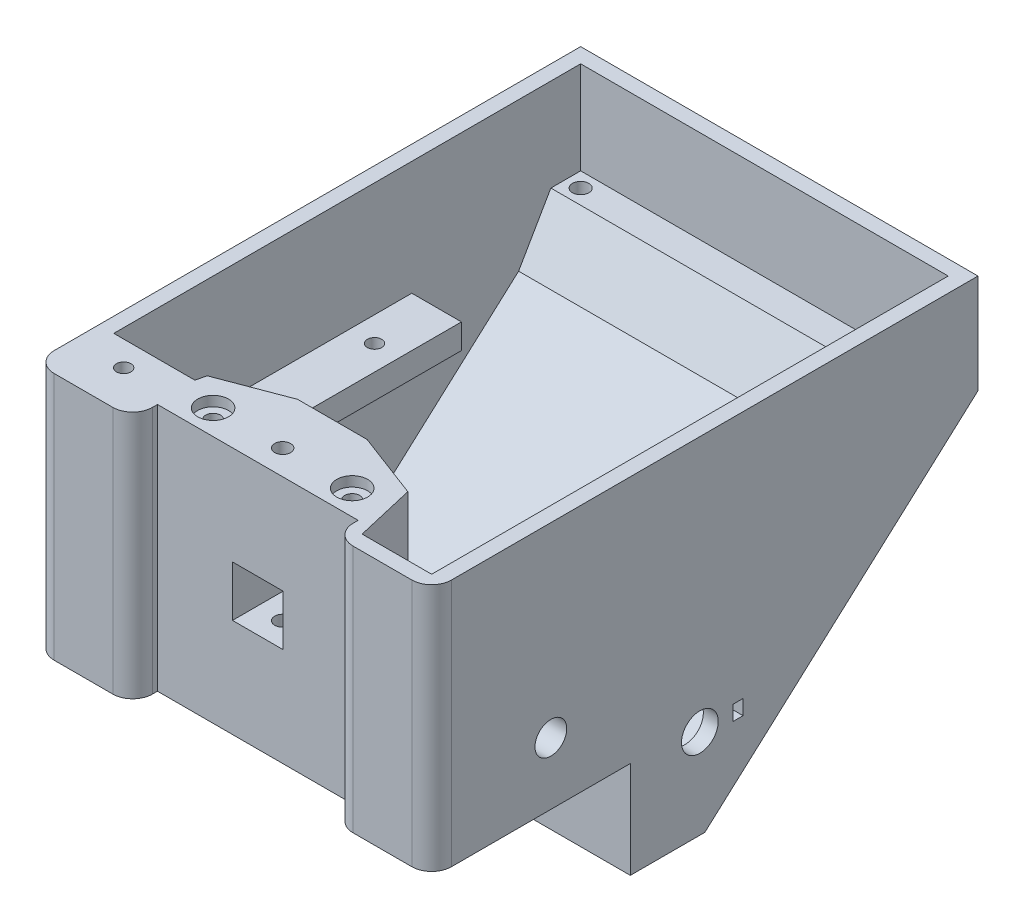
from build123d import *

# Parameters (mm, degrees)
BOSS_EXTRUDE1_DEPTH  = 80
SHELL1_T             = -3
SKETCH3_W            = 46
SKETCH3_H            = 47
BOSS_EXTRUDE2_DEPTH  = 17
SKETCH4_W            = 10.2
SKETCH4_H            = 10.2
CUT_EXTRUDE1_DEPTH   = 20
SKETCH6_W            = 15
SKETCH6_H            = 12.8
CUT_EXTRUDE2_DEPTH   = 3
SKETCH7_W            = 40.4
SKETCH7_H            = 50
CUT_EXTRUDE3_DEPTH   = 5
FILLET1_R            = 4
CUT_EXTRUDE7_DEPTH   = 47
SKETCH13_R           = 1.5
CUT_EXTRUDE8_DEPTH   = 25
SKETCH14_R           = 3.1
CUT_EXTRUDE9_DEPTH   = 2
SKETCH17_W           = 45
SKETCH17_H           = 5
BOSS_EXTRUDE5_DEPTH  = 74
CUT_EXTRUDE10_REACH  = 126.093
SKETCH18_W           = 54
SKETCH18_H           = 45
CUT_EXTRUDE11_REACH  = 126.093
SKETCH19_R           = 1.45
BOSS_EXTRUDE6_DEPTH  = 47
SKETCH22_R           = 1.45
CUT_EXTRUDE12_DEPTH  = 135.415364765
CUT_EXTRUDE13_REACH  = 126.857
SKETCH24_R           = 3.7
SKETCH24_W           = 2
SKETCH24_H           = 3
BOSS_EXTRUDE7_DEPTH  = 74
SKETCH27_R           = 1.65
CUT_EXTRUDE14_DEPTH  = 10
CUT_EXTRUDE15_START  = -3
CUT_EXTRUDE15_DEPTH  = 32
CUT_EXTRUDE16_DEPTH  = 30
BOSS_EXTRUDE8_DEPTH  = 20
SKETCH31_R           = 1.5
CUT_EXTRUDE17_DEPTH  = 123.649786567
CUT_EXTRUDE18_DEPTH  = 15
CUT_EXTRUDE19_REACH  = 126.093
SKETCH33_W           = 10
SKETCH33_H           = 5
SKETCH34_R           = 1.6
CUT_EXTRUDE20_DEPTH  = 135.415364765
CUT_EXTRUDE22_DEPTH  = 14
CUT_EXTRUDE23_REACH  = 126.857
SKETCH37_R           = 3.2
SKETCH38_W           = 10
SKETCH38_H           = 18.980735551
SKETCH38_R           = 3.2
BOSS_EXTRUDE9_DEPTH  = 3
CUT_EXTRUDE24_REACH  = 124.956
SKETCH40_R           = 3.7
SKETCH40_W           = 2
SKETCH40_H           = 3
CHAMFER1_SIZE        = 10
CHAMFER1_SIZE_2      = 17.320508076
SKETCH41_W           = 6.5
SKETCH41_H           = 6.5
CUT_EXTRUDE25_DEPTH  = 1
SKETCH42_R           = 2.25
CUT_EXTRUDE26_DEPTH  = 125.659140511
SKETCH43_R           = 4
SKETCH43_R_2         = 2.25
BOSS_EXTRUDE10_DEPTH = 2
FILLET2_R            = 2
FILLET3_R            = 1
SKETCH44_W           = 9
SKETCH44_H           = 9
SKETCH44_W_2         = 6.5
SKETCH44_H_2         = 6.5
BOSS_EXTRUDE11_DEPTH = 2


# Some blends are built 0.0001 mm under size
with BuildPart() as part:
    # Sketch2 → Boss-Extrude1 (new body)
    with BuildSketch(Plane(origin=(0, 0, 0), x_dir=(0, 0, -1), z_dir=(1, 0, 0))):
        Polygon((-27.320490368, 20.998248687), (-27.320490368, -29.001751313), (12.679509632, -29.001751313), (12.679509632, -48.511383538), (27.679509632, -48.511383538), (82.679509632, 0.998248687), (82.679509632, 20.998248687), align=None)
    extrude(amount=BOSS_EXTRUDE1_DEPTH)

    # Shell1
    shell1_openings = [part.faces().sort_by_distance(p)[0] for p in [
        (40, 20.998248687, -27.679509632),
    ]]
    offset(amount=SHELL1_T, openings=shell1_openings, kind=Kind.INTERSECTION)

    # Sketch3 → Boss-Extrude2 (add)
    with BuildSketch(Plane(origin=(0, 0, 24.320490368), x_dir=(-1, 0, 0), z_dir=(0, 0, -1))):
        with Locations((-40, -2.501751313)):
            Rectangle(SKETCH3_W, SKETCH3_H)
    extrude(amount=BOSS_EXTRUDE2_DEPTH)

    # Sketch4 → Cut-Extrude1 (cut)
    with BuildSketch(Plane.XY.offset(27.320490368)):
        with Locations((40, -4.001751313)):
            Rectangle(SKETCH4_W, SKETCH4_H)
    extrude(amount=-CUT_EXTRUDE1_DEPTH, mode=Mode.SUBTRACT)

    # Sketch6 → Cut-Extrude2 (cut)
    with BuildSketch(Plane.XZ.offset(29.001751313)):
        with Locations((28.5, 0.920490368)):
            Rectangle(SKETCH6_W, SKETCH6_H)
        with Locations((51.5, 0.920490368)):
            Rectangle(SKETCH6_W, SKETCH6_H)
    extrude(amount=-CUT_EXTRUDE2_DEPTH, mode=Mode.SUBTRACT)

    # Sketch7 → Cut-Extrude3 (cut)
    with BuildSketch(Plane.XY.offset(27.320490368)):
        with Locations((40, -4.001751313)):
            Rectangle(SKETCH7_W, SKETCH7_H)
    extrude(amount=-CUT_EXTRUDE3_DEPTH, mode=Mode.SUBTRACT)

    # Fillet1
    fillet1_edges = [part.edges().sort_by_distance(p)[0] for p in [
        (19.8, -4.001751313, 27.320490368),
        (60.2, -4.001751313, 27.320490368),
        (80, -4.001751313, 27.320490368),
        (0, -4.001751313, 27.320490368),
    ]]
    fillet(fillet1_edges, radius=FILLET1_R)

    # Sketch12 → Cut-Extrude7 (cut)
    with BuildSketch(Plane(origin=(0, 20.998248687, 0), x_dir=(1, 0, 0), z_dir=(0, 1, 0))):
        Polygon((33, -7.320490368), (19.8, -12.320490368), (17, -24.320490368), (17, -7.320490368), align=None)
        Polygon((47, -7.320490368), (63, -7.320490368), (63, -24.320490368), (60.2, -12.320490368), align=None)
    extrude(amount=-CUT_EXTRUDE7_DEPTH, mode=Mode.SUBTRACT)

    # Sketch13 → Cut-Extrude8 (cut)
    with BuildSketch(Plane(origin=(0, 20.998248687, 0), x_dir=(1, 0, 0), z_dir=(0, 1, 0))):
        with Locations(Location((26, -17.320490368, 0), (0, 0, 270))):
            Circle(SKETCH13_R)
        with Locations(Location((54, -17.320490368, 0), (0, 0, 270))):
            Circle(SKETCH13_R)
    extrude(amount=-CUT_EXTRUDE8_DEPTH, mode=Mode.SUBTRACT)

    # Sketch14 → Cut-Extrude9 (cut)
    with BuildSketch(Plane(origin=(0, 20.998248687, 0), x_dir=(1, 0, 0), z_dir=(0, 1, 0))):
        with Locations(Location((26, -17.320490368, 0), (0, 0, 270))):
            Circle(SKETCH14_R)
        with Locations(Location((54, -17.320490368, 0), (0, 0, 270))):
            Circle(SKETCH14_R)
    extrude(amount=-CUT_EXTRUDE9_DEPTH, mode=Mode.SUBTRACT)

    # Sketch17 → Boss-Extrude5 (add)
    with BuildSketch(Plane.ZY.offset(-77)):
        with Locations((-23.179509632, -4.501751313)):
            Rectangle(SKETCH17_W, SKETCH17_H)
    extrude(amount=BOSS_EXTRUDE5_DEPTH)

    # Sketch18 → Cut-Extrude10 (cut, up to next)
    with BuildSketch(Plane(origin=(0, -2.001751313, 0), x_dir=(1, 0, 0), z_dir=(0, 1, 0)), mode=Mode.PRIVATE) as cut_extrude10_sk1:
        with Locations((40, 23.179509632)):
            Rectangle(SKETCH18_W, SKETCH18_H)
    cut_extrude10_tool1 = extrude(cut_extrude10_sk1.sketch, amount=-CUT_EXTRUDE10_REACH, mode=Mode.PRIVATE) & part.part
    add(cut_extrude10_tool1.solids().sort_by_distance((40, -2.001751, -23.17951))[0], mode=Mode.SUBTRACT)

    # Sketch19 → Cut-Extrude11 (cut, up to next)
    with BuildSketch(Plane(origin=(0, -2.001751313, 0), x_dir=(1, 0, 0), z_dir=(0, 1, 0)), mode=Mode.PRIVATE) as cut_extrude11_sk1:
        with Locations(Location((72, 37.179509632, 0), (0, 0, 270))):
            Circle(SKETCH19_R)
    cut_extrude11_tool1 = extrude(cut_extrude11_sk1.sketch, amount=-CUT_EXTRUDE11_REACH, mode=Mode.PRIVATE) & part.part
    # Sketch19 → Cut-Extrude11 (cut, up to next)
    with BuildSketch(Plane(origin=(0, -2.001751313, 0), x_dir=(1, 0, 0), z_dir=(0, 1, 0)), mode=Mode.PRIVATE) as cut_extrude11_sk2:
        with Locations(Location((72, 6.179509632, 0), (0, 0, 270))):
            Circle(SKETCH19_R)
    cut_extrude11_tool2 = extrude(cut_extrude11_sk2.sketch, amount=-CUT_EXTRUDE11_REACH, mode=Mode.PRIVATE) & part.part
    # Sketch19 → Cut-Extrude11 (cut, up to next)
    with BuildSketch(Plane(origin=(0, -2.001751313, 0), x_dir=(1, 0, 0), z_dir=(0, 1, 0)), mode=Mode.PRIVATE) as cut_extrude11_sk3:
        with Locations(Location((8, 33.179509632, 0), (0, 0, 270))):
            Circle(SKETCH19_R)
    cut_extrude11_tool3 = extrude(cut_extrude11_sk3.sketch, amount=-CUT_EXTRUDE11_REACH, mode=Mode.PRIVATE) & part.part
    # Sketch19 → Cut-Extrude11 (cut, up to next)
    with BuildSketch(Plane(origin=(0, -2.001751313, 0), x_dir=(1, 0, 0), z_dir=(0, 1, 0)), mode=Mode.PRIVATE) as cut_extrude11_sk4:
        with Locations(Location((8, 6.179509632, 0), (0, 0, 270))):
            Circle(SKETCH19_R)
    cut_extrude11_tool4 = extrude(cut_extrude11_sk4.sketch, amount=-CUT_EXTRUDE11_REACH, mode=Mode.PRIVATE) & part.part
    add(cut_extrude11_tool1.solids().sort_by_distance((72, -2.001751, -37.17951))[0], mode=Mode.SUBTRACT)
    add(cut_extrude11_tool2.solids().sort_by_distance((72, -2.001751, -6.17951))[0], mode=Mode.SUBTRACT)
    add(cut_extrude11_tool3.solids().sort_by_distance((8, -2.001751, -33.17951))[0], mode=Mode.SUBTRACT)
    add(cut_extrude11_tool4.solids().sort_by_distance((8, -2.001751, -6.17951))[0], mode=Mode.SUBTRACT)

    # Sketch21 → Boss-Extrude6 (add)
    with BuildSketch(Plane(origin=(0, -26.001751313, 0), x_dir=(1, 0, 0), z_dir=(0, 1, 0))):
        Polygon((3, -24.320490368), (3, -14.320490368), (19.333333333, -14.320490368), (17, -24.320490368), align=None)
    extrude(amount=BOSS_EXTRUDE6_DEPTH)

    # Sketch22 → Cut-Extrude12 (cut, through all)
    with BuildSketch(Plane(origin=(0, 20.998248687, 0), x_dir=(1, 0, 0), z_dir=(0, 1, 0))):
        with Locations(Location((10, -19.320490368, 0), (0, 0, 270))):
            Circle(SKETCH22_R)
    extrude(amount=-CUT_EXTRUDE12_DEPTH, mode=Mode.SUBTRACT)

    # Sketch24 → Cut-Extrude13 (cut, up to next)
    with BuildSketch(Plane(origin=(80, 0, 0), x_dir=(0, 0, -1), z_dir=(1, 0, 0)), mode=Mode.PRIVATE) as cut_extrude13_sk1:
        with Locations((26.679509632, -30.511383538)):
            Circle(SKETCH24_R)
    cut_extrude13_tool1 = extrude(cut_extrude13_sk1.sketch, amount=-CUT_EXTRUDE13_REACH, mode=Mode.PRIVATE) & part.part
    # Sketch24 → Cut-Extrude13 (cut, up to next)
    with BuildSketch(Plane(origin=(80, 0, 0), x_dir=(0, 0, -1), z_dir=(1, 0, 0)), mode=Mode.PRIVATE) as cut_extrude13_sk2:
        with Locations((34.379509632, -30.511383538)):
            Rectangle(SKETCH24_W, SKETCH24_H)
    cut_extrude13_tool2 = extrude(cut_extrude13_sk2.sketch, amount=-CUT_EXTRUDE13_REACH, mode=Mode.PRIVATE) & part.part
    add(cut_extrude13_tool1.solids().sort_by_distance((80, -30.511384, -26.67951))[0], mode=Mode.SUBTRACT)
    add(cut_extrude13_tool2.solids().sort_by_distance((80, -30.511384, -34.37951))[0], mode=Mode.SUBTRACT)

    # Sketch26 → Boss-Extrude7 (add)
    with BuildSketch(Plane(origin=(3, 0, 0), x_dir=(0, 0, -1), z_dir=(1, 0, 0))):
        Polygon((79.679509632, 2.334161996), (63.679509632, 2.334161996), (63.679509632, -12.068640106), align=None)
    extrude(amount=BOSS_EXTRUDE7_DEPTH)

    # Sketch27 → Cut-Extrude14 (cut)
    with BuildSketch(Plane(origin=(0, 2.334161996, 0), x_dir=(1, 0, 0), z_dir=(0, 1, 0))):
        with Locations(Location((6, 76.679509632, 0), (0, 0, 270))):
            Circle(SKETCH27_R)
        with Locations(Location((74, 76.679509632, 0), (0, 0, 270))):
            Circle(SKETCH27_R)
    extrude(amount=-CUT_EXTRUDE14_DEPTH, mode=Mode.SUBTRACT)

    # Sketch28 → Cut-Extrude15 (cut)
    with BuildSketch(Plane(origin=(0, 2.334161996, 0), x_dir=(1, 0, 0), z_dir=(0, 1, 0)).offset(CUT_EXTRUDE15_START)):
        Polygon((74, 79.929509632), (71.185417438, 78.304509632), (71.185417438, 75.054509632), (74, 73.429509632), (76.814582562, 75.054509632), (76.814582562, 78.304509632), align=None)
        Polygon((6, 73.429509632), (8.814582562, 75.054509632), (8.814582562, 78.304509632), (6, 79.929509632), (3.185417438, 78.304509632), (3.185417438, 75.054509632), align=None)
    extrude(amount=-CUT_EXTRUDE15_DEPTH, mode=Mode.SUBTRACT)

    # Sketch29 → Cut-Extrude16 (cut)
    with BuildSketch(Plane.XZ.offset(29.001751313)):
        Polygon((7.185417438, 17.695490368), (10, 16.070490368), (12.814582562, 17.695490368), (12.814582562, 20.945490368), (10, 22.570490368), (7.185417438, 20.945490368), align=None)
    extrude(amount=-CUT_EXTRUDE16_DEPTH, mode=Mode.SUBTRACT)

    # Sketch30 → Boss-Extrude8 (add)
    with BuildSketch(Plane(origin=(0, -26.001751313, 0), x_dir=(1, 0, 0), z_dir=(0, 1, 0))):
        Polygon((77, -24.320490368), (63, -24.320490368), (60.2, -12.320490368), (77, -12.320490368), align=None)
    extrude(amount=BOSS_EXTRUDE8_DEPTH)

    # Sketch31 → Cut-Extrude17 (cut, through all)
    with BuildSketch(Plane(origin=(0, -6.001751313, 0), x_dir=(1, 0, 0), z_dir=(0, 1, 0))):
        with Locations(Location((72, -21.320490368, 0), (0, 0, 270))):
            Circle(SKETCH31_R)
    extrude(amount=-CUT_EXTRUDE17_DEPTH, mode=Mode.SUBTRACT)

    # Sketch32 → Cut-Extrude18 (cut)
    with BuildSketch(Plane.XZ.offset(29.001751313)):
        Polygon((72, 24.570490368), (69.185417438, 22.945490368), (69.185417438, 19.695490368), (72, 18.070490368), (74.814582562, 19.695490368), (74.814582562, 22.945490368), align=None)
    extrude(amount=-CUT_EXTRUDE18_DEPTH, mode=Mode.SUBTRACT)

    # Sketch33 → Cut-Extrude19 (cut, up to next)
    with BuildSketch(Plane(origin=(0, -2.001751313, 0), x_dir=(1, 0, 0), z_dir=(0, 1, 0)), mode=Mode.PRIVATE) as cut_extrude19_sk1:
        with Locations((72, 43.179509632)):
            Rectangle(SKETCH33_W, SKETCH33_H)
    cut_extrude19_tool1 = extrude(cut_extrude19_sk1.sketch, amount=-CUT_EXTRUDE19_REACH, mode=Mode.PRIVATE) & part.part
    add(cut_extrude19_tool1.solids().sort_by_distance((72, -2.001751, -43.17951))[0], mode=Mode.SUBTRACT)

    # Sketch34 → Cut-Extrude20 (cut, through all)
    with BuildSketch(Plane(origin=(0, 20.998248687, 0), x_dir=(1, 0, 0), z_dir=(0, 1, 0))):
        with Locations(Location((40, -17.320490368, 0), (0, 0, 270))):
            Circle(SKETCH34_R)
    extrude(amount=-CUT_EXTRUDE20_DEPTH, mode=Mode.SUBTRACT)

    # Sketch36 → Cut-Extrude22 (cut)
    with BuildSketch(Plane.XZ.offset(29.001751313)):
        Polygon((38.375, 20.13507293), (36.75, 17.320490368), (38.375, 14.505907805), (41.625, 14.505907805), (43.25, 17.320490368), (41.625, 20.13507293), align=None)
    extrude(amount=-CUT_EXTRUDE22_DEPTH, mode=Mode.SUBTRACT)

    # Sketch37 → Cut-Extrude23 (cut, up to next)
    with BuildSketch(Plane(origin=(80, 0, 0), x_dir=(0, 0, -1), z_dir=(1, 0, 0)), mode=Mode.PRIVATE) as cut_extrude23_sk1:
        with Locations((-3.320490368, -16.511383538)):
            Circle(SKETCH37_R)
    cut_extrude23_tool1 = extrude(cut_extrude23_sk1.sketch, amount=-CUT_EXTRUDE23_REACH, mode=Mode.PRIVATE) & part.part
    add(cut_extrude23_tool1.solids().sort_by_distance((80, -16.511384, 3.32049))[0], mode=Mode.SUBTRACT)

    # Sketch38 → Boss-Extrude9 (add)
    with BuildSketch(Plane.ZY.offset(-77)):
        with Locations((3.320490368, -16.511383538)):
            Rectangle(SKETCH38_W, SKETCH38_H)
        with Locations(Location((3.320490368, -16.511383538, 0), (0, 0, 180))):
            Circle(SKETCH38_R, mode=Mode.SUBTRACT)
    extrude(amount=BOSS_EXTRUDE9_DEPTH)

    # Sketch40 → Cut-Extrude24 (cut, up to next)
    with BuildSketch(Plane(origin=(3, 0, 0), x_dir=(0, 0, -1), z_dir=(1, 0, 0)), mode=Mode.PRIVATE) as cut_extrude24_sk1:
        with Locations((26.679509632, -30.511383538)):
            Circle(SKETCH40_R)
    cut_extrude24_tool1 = extrude(cut_extrude24_sk1.sketch, amount=-CUT_EXTRUDE24_REACH, mode=Mode.PRIVATE) & part.part
    # Sketch40 → Cut-Extrude24 (cut, up to next)
    with BuildSketch(Plane(origin=(3, 0, 0), x_dir=(0, 0, -1), z_dir=(1, 0, 0)), mode=Mode.PRIVATE) as cut_extrude24_sk2:
        with Locations((18.979509632, -30.511383538)):
            Rectangle(SKETCH40_W, SKETCH40_H)
    cut_extrude24_tool2 = extrude(cut_extrude24_sk2.sketch, amount=-CUT_EXTRUDE24_REACH, mode=Mode.PRIVATE) & part.part
    add(cut_extrude24_tool1.solids().sort_by_distance((3, -30.511384, -26.67951))[0], mode=Mode.SUBTRACT)
    add(cut_extrude24_tool2.solids().sort_by_distance((3, -30.511384, -18.97951))[0], mode=Mode.SUBTRACT)

    # Chamfer1
    # the kernel refuses this chamfer: 17.320508076, 10 mm, written as the material it takes off along each edge
    with BuildSketch(Plane(origin=(3, 2.334161996, -63.679509632), x_dir=(0, 0.057893862402671574, -0.9983227437537926), z_dir=(1, 0, 0))) as chamfer1_piece_1_section:
        Polygon((CHAMFER1_SIZE * 0.998322743754, -CHAMFER1_SIZE * 0.0578938624027), (-CHAMFER1_SIZE_2 * 0.0578938624016, -CHAMFER1_SIZE_2 * 0.998322743736), (0, 0), align=None)
    chamfer1_piece_1 = extrude(amount=74, mode=Mode.PRIVATE)
    chamfer1_piece_1 = split(chamfer1_piece_1, bisect_by=Plane(origin=(40, -6.240713773, -70.153723515), z_dir=(0, 0.7432294209486892, 0.6690366416245648)), keep=Keep.TOP, mode=Mode.PRIVATE)
    add(chamfer1_piece_1, mode=Mode.SUBTRACT)

    # Sketch41 → Cut-Extrude25 (cut)
    with BuildSketch(Plane(origin=(0, -26.001751313, 0), x_dir=(1, 0, 0), z_dir=(0, 1, 0))):
        with Locations((12, -0.920490368)):
            Rectangle(SKETCH41_W, SKETCH41_H)
    extrude(amount=-CUT_EXTRUDE25_DEPTH, mode=Mode.SUBTRACT)

    # Sketch42 → Cut-Extrude26 (cut, through all)
    with BuildSketch(Plane(origin=(0, -27.001751313, 0), x_dir=(1, 0, 0), z_dir=(0, 1, 0))):
        with Locations(Location((12, -0.920490368, 0), (0, 0, 270))):
            Circle(SKETCH42_R)
    extrude(amount=-CUT_EXTRUDE26_DEPTH, mode=Mode.SUBTRACT)

    # Sketch43 → Boss-Extrude10 (add)
    with BuildSketch(Plane.XZ.offset(29.001751313)):
        with Locations(Location((12, 0.920490368, 0), (0, 0, 90))):
            Circle(SKETCH43_R)
        with Locations(Location((12, 0.920490368, 0), (0, 0, 90))):
            Circle(SKETCH43_R_2, mode=Mode.SUBTRACT)
    extrude(amount=BOSS_EXTRUDE10_DEPTH)

    # Fillet2
    fillet2_edges = [part.edges().sort_by_distance(p)[0] for p in [
        (12, -29.001751313, -3.079509632),
    ]]
    fillet(fillet2_edges, radius=FILLET2_R - 0.0001)  # a hair under: the kernel refuses the full size

    # Fillet3
    fillet3_edges = [part.edges().sort_by_distance(p)[0] for p in [
        (12, -31.001751313, -3.079509632),
    ]]
    fillet(fillet3_edges, radius=FILLET3_R)

    # Sketch44 → Boss-Extrude11 (add)
    with BuildSketch(Plane(origin=(0, -26.001751313, 0), x_dir=(1, 0, 0), z_dir=(0, 1, 0))):
        with Locations((12, -0.920490368)):
            Rectangle(SKETCH44_W, SKETCH44_H)
        with Locations((12, -0.920490368)):
            Rectangle(SKETCH44_W_2, SKETCH44_H_2, mode=Mode.SUBTRACT)
    extrude(amount=BOSS_EXTRUDE11_DEPTH)


solid = part.part
